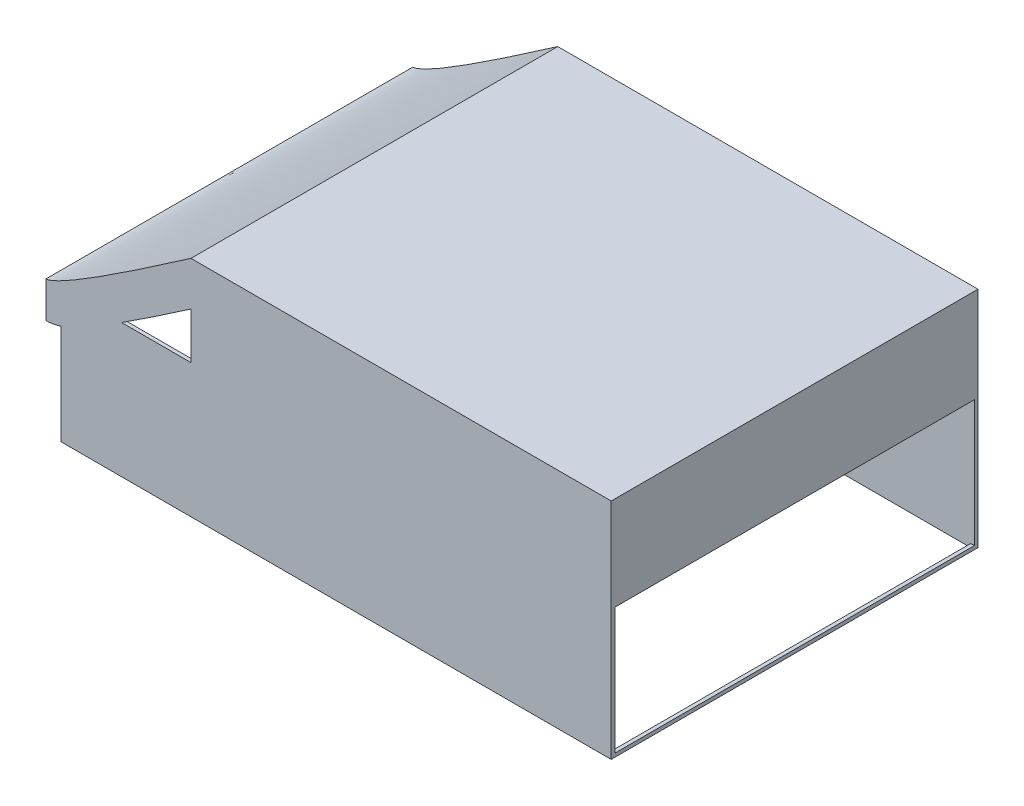
from build123d import *

# Parameters (mm, degrees)
SKETCH1_W           = 152.4
SKETCH1_H           = 37
BOSS_EXTRUDE1_DEPTH = 101.6
SKETCH2_W           = 99.6
SKETCH2_H           = 35
CUT_EXTRUDE1_DEPTH  = 185.093916249
SKETCH3_W           = 150.4
SKETCH3_H           = 99.6
CUT_EXTRUDE2_DEPTH  = 133.280006048
EXTRUDE_THIN4_START = -101.6
EXTRUDE_THIN4_DEPTH = 101.6
SKETCH9_W           = 106.403135183
SKETCH9_H           = 5
BOSS_EXTRUDE4_DEPTH = 101.6


# Read off the part's stored shape, not the designer's step: Extrude-Thin4
with BuildPart() as part:
    # Sketch1 → Boss-Extrude1 (new body)
    with BuildSketch(Plane.XY):
        Rectangle(SKETCH1_W, SKETCH1_H)
    extrude(amount=BOSS_EXTRUDE1_DEPTH)

    # Sketch2 → Cut-Extrude1 (cut, through all)
    with BuildSketch(Plane.ZY.offset(76.2)):
        with Locations((50.8, 0)):
            Rectangle(SKETCH2_W, SKETCH2_H)
    extrude(amount=-CUT_EXTRUDE1_DEPTH, mode=Mode.SUBTRACT)

    # Sketch3 → Cut-Extrude2 (cut, through all)
    with BuildSketch(Plane(origin=(0, 18.5, 0), x_dir=(1, 0, 0), z_dir=(0, 1, 0))):
        with Locations((0, -50.8)):
            Rectangle(SKETCH3_W, SKETCH3_H)
    extrude(amount=-CUT_EXTRUDE2_DEPTH, mode=Mode.SUBTRACT)

    # Extrude-Thin4 outline → Extrude-Thin4 (add)
    with BuildSketch(Plane(origin=(0, 0, 0), x_dir=(-1, 0, 0), z_dir=(0, 0, -1)).offset(EXTRUDE_THIN4_START)):
        with BuildLine():
            Line((-76.2, 43.5), (-76.2, 18.5))
            Line((-76.2, 18.5), (40.203135183, 18.5))
            Line((40.203135183, 18.5), (40.203135183, 28.5))
            Line((40.203135183, 28.5), (-66.2, 28.5))
            Line((-66.2, 28.5), (-66.2, 33.5))
            Line((-66.2, 33.5), (37.076687279, 33.5))
            add(Edge.make_bspline(
                [(37.076687279, 33.5), (42.712503235, 29.602755941), (47.740101517, 26.184011055), (56.600294641, 20.291071098), (60.430190038, 17.818058565), (65.330997145, 14.789830611), (66.824161054, 13.89378122), (69.560877297, 12.31480535), (70.801570346, 11.632483882), (72.54251455, 10.745567395), (73.103276521, 10.472479574), (74.21882377, 9.963704392), (74.771996239, 9.727837773), (75.629792754, 9.404385606), (75.906990567, 9.305691485), (76.2, 9.210010654)],
                knots=[0, 0, 0, 0, 0.25, 0.25, 0.5, 0.5, 0.625, 0.625, 0.75, 0.75, 0.8125, 0.8125, 0.875, 0.875, 0.903624295, 0.903624295, 0.903624295, 0.903624295], degree=3))
            add(Edge.make_bspline(
                [(76.2, 9.210010654), (76.22687774, 9.201233856), (76.253888525, 9.192482414), (76.604166758, 9.079903255), (76.946677128, 8.979439764), (77.707610171, 8.79063089), (78.125422966, 8.701549246), (79.103306411, 8.557457163), (79.663066468, 8.499997568), (80.351085446, 8.499997395)],
                knots=[0.903624295, 0.903624295, 0.903624295, 0.903624295, 0.90625, 0.90625, 0.9375, 0.9375, 0.96875, 0.96875, 1, 1, 1, 1], degree=3))
            Line((80.351085446, 8.499997395), (80.351087966, 18.499997395))
            add(Edge.make_bspline(
                [(40.203135183, 43.5), (76.200002245, 18.499998441), (80.351087966, 18.499997395)],
                knots=[0, 0, 0, 1, 1, 1], degree=2))
            Line((40.203135183, 43.5), (-76.2, 43.5))
        make_face()
    extrude(amount=EXTRUDE_THIN4_DEPTH)

    # Sketch9 → Boss-Extrude4 (add)
    with BuildSketch(Plane(origin=(0, 0, 0), x_dir=(-1, 0, 0), z_dir=(0, 0, -1))):
        with Locations((-12.998432409, 31)):
            Rectangle(SKETCH9_W, SKETCH9_H)
    extrude(amount=-BOSS_EXTRUDE4_DEPTH)


solid = part.part
